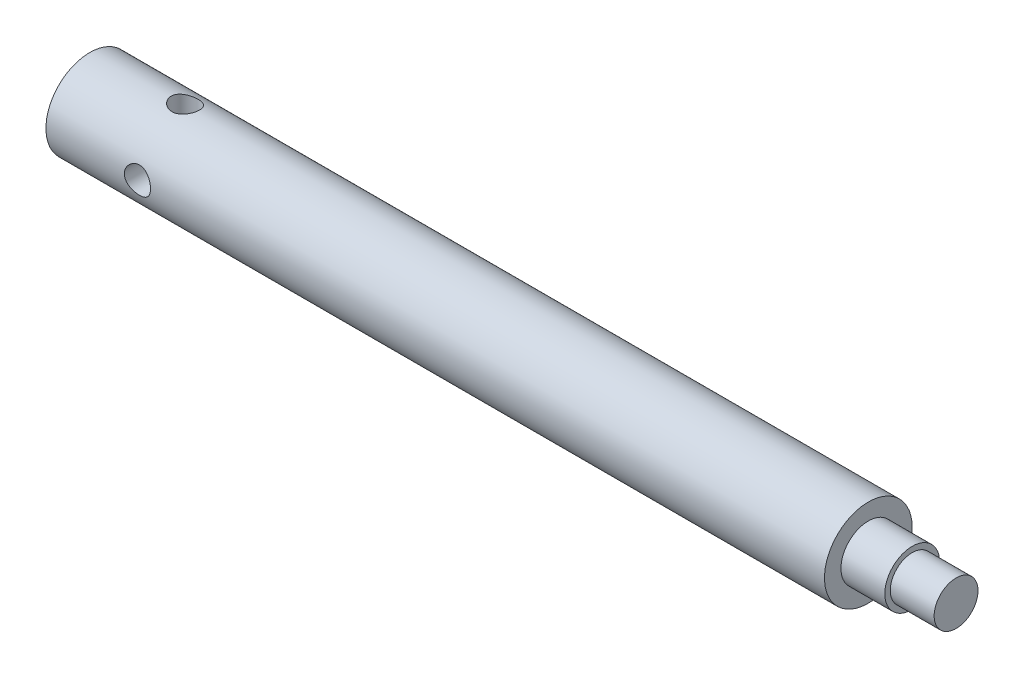
from build123d import *

# Parameters (mm, degrees)
SKETCH1_R              = 6.35
BOSS_EXTRUDE1_DEPTH    = 125.4125
SKETCH2_R              = 1.89611
CUT_EXTRUDE1_DEPTH     = 3.175
CUT_EXTRUDE2_START     = 3.175
CUT_EXTRUDE2_OUTLINE_R = 1.89611
CUT_EXTRUDE2_DEPTH     = 3.1750001
SKETCH3_OUTSIDE_W      = 40.038
SKETCH3_OUTSIDE_H      = 40.038
SKETCH3_OUTSIDE_R      = 3.175
CUT_EXTRUDE3_DEPTH     = 12.7
SKETCH4_R              = 3.96875
BOSS_EXTRUDE2_DEPTH    = 6.35


# Read off the part's stored shape, not the designer's step: Cut-Extrude2
with BuildPart() as part:
    # Sketch1 → Boss-Extrude1 (new body)
    with BuildSketch(Plane(origin=(0, 0, 0), x_dir=(0, 0, -1), z_dir=(1, 0, 0))):
        with Locations((6.35, 0)):
            Circle(SKETCH1_R)
    extrude(amount=BOSS_EXTRUDE1_DEPTH)

    # Sketch2 → Cut-Extrude1 (cut)
    with BuildSketch(Plane.XY):
        with Locations((13.24991, 0)):
            Circle(SKETCH2_R)
    extrude(amount=-CUT_EXTRUDE1_DEPTH, mode=Mode.SUBTRACT)

    # Cut-Extrude2 outline → Cut-Extrude2 (cut)
    with BuildSketch(Plane(origin=(0, 0, 0), x_dir=(1, 0, 0), z_dir=(0, 1, 0)).offset(CUT_EXTRUDE2_START)):
        with Locations((13.23805984, 6.910255895)):
            Circle(CUT_EXTRUDE2_OUTLINE_R)
    extrude(amount=CUT_EXTRUDE2_DEPTH, mode=Mode.SUBTRACT)

    # Sketch3 outside → Cut-Extrude3 (cut)
    with BuildSketch(Plane(origin=(125.4125, 0, 0), x_dir=(0, 0, -1), z_dir=(1, 0, 0))):
        with Locations((6.35, 0)):
            Rectangle(SKETCH3_OUTSIDE_W, SKETCH3_OUTSIDE_H)
        with Locations((6.35, 0)):
            Circle(SKETCH3_OUTSIDE_R, mode=Mode.SUBTRACT)
    extrude(amount=-CUT_EXTRUDE3_DEPTH, mode=Mode.SUBTRACT)

    # Sketch4 → Boss-Extrude2 (add)
    with BuildSketch(Plane(origin=(112.7125, 0, 0), x_dir=(0, 0, -1), z_dir=(1, 0, 0))):
        with Locations((6.35, 0)):
            Circle(SKETCH4_R)
    extrude(amount=BOSS_EXTRUDE2_DEPTH)


solid = part.part
